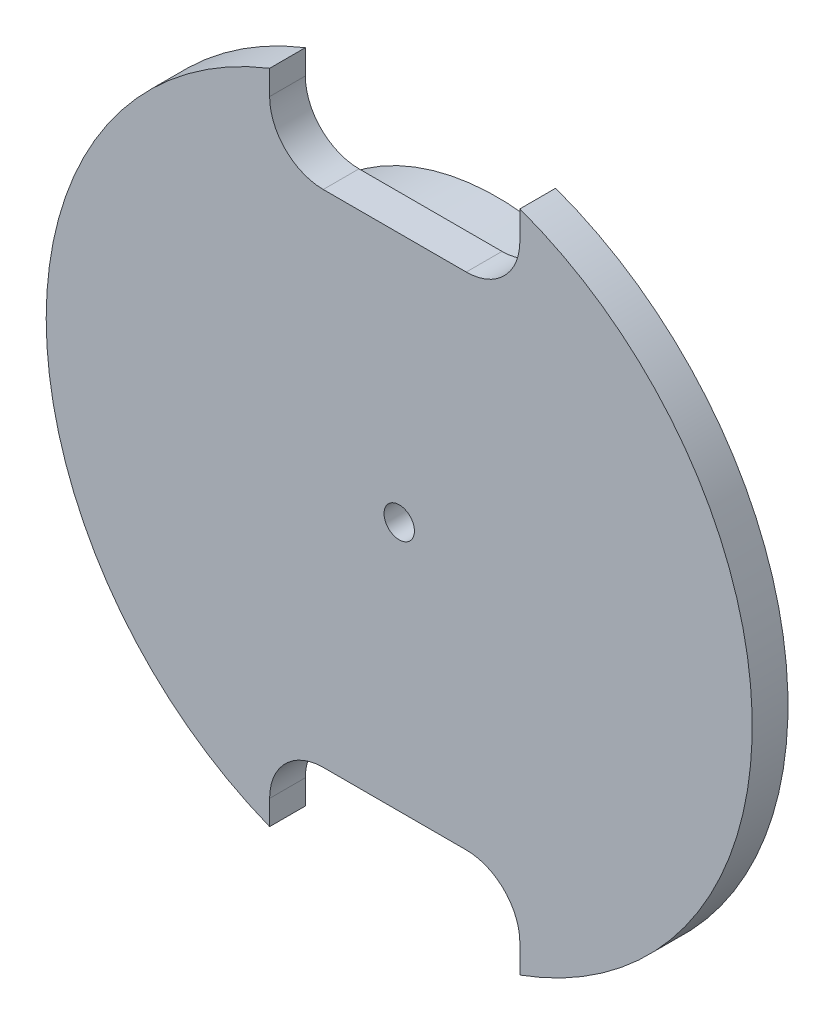
from build123d import *

# Parameters (mm, degrees)
SKETCH1_R           = 39.5
BOSS_EXTRUDE1_DEPTH = 4
CUT_EXTRUDE2_DEPTH  = 10
SKETCH7_R           = 26
BOSS_EXTRUDE2_DEPTH = 7
SKETCH8_R           = 1.7
CUT_EXTRUDE3_DEPTH  = 20
SKETCH9_R           = 5
CUT_EXTRUDE4_DEPTH  = 4


with BuildPart() as part:
    # Sketch1 → Boss-Extrude1 (new body)
    with BuildSketch(Plane.XY):
        with Locations((-12.82554103, 19.238311544)):
            Circle(SKETCH1_R)
    extrude(amount=BOSS_EXTRUDE1_DEPTH)

    # Sketch5 → Cut-Extrude2 (cut)
    with BuildSketch(Plane.XY.offset(4)):
        with BuildLine():
            Line((-27.32554103, 65.055026052), (-27.32554103, 53.238311544))
            ThreePointArc((-27.32554103, 53.238311544), (-25.568181717, 48.995670857), (-21.32554103, 47.238311544))
            Line((-21.32554103, 47.238311544), (-5.32554103, 47.238311544))
            ThreePointArc((-5.32554103, 47.238311544), (-1.082900342, 48.995670857), (0.67445897, 53.238311544))
            Line((0.67445897, 53.238311544), (0.67445897, 65.055026052))
            Line((0.67445897, 65.055026052), (-27.32554103, 65.055026052))
        make_face()
        with BuildLine():
            Line((-5.32554103, -8.761688456), (-21.32554103, -8.761688456))
            ThreePointArc((-21.32554103, -8.761688456), (-25.568181717, -10.519047769), (-27.32554103, -14.761688456))
            Line((-27.32554103, -14.761688456), (-27.32554103, -23.849725684))
            Line((-27.32554103, -23.849725684), (0.67445897, -23.849725684))
            Line((0.67445897, -23.849725684), (0.67445897, -14.761688456))
            ThreePointArc((0.67445897, -14.761688456), (-1.082900342, -10.519047769), (-5.32554103, -8.761688456))
        make_face()
    extrude(amount=-CUT_EXTRUDE2_DEPTH, mode=Mode.SUBTRACT)

    # Sketch7 → Boss-Extrude2 (add)
    with BuildSketch(Plane(origin=(0, 0, 0), x_dir=(-1, 0, 0), z_dir=(0, 0, -1))):
        with Locations((12.82554103, 19.238311544)):
            Circle(SKETCH7_R)
    extrude(amount=BOSS_EXTRUDE2_DEPTH)

    # Sketch8 → Cut-Extrude3 (cut)
    with BuildSketch(Plane(origin=(0, 0, -7), x_dir=(-1, 0, 0), z_dir=(0, 0, -1))):
        with Locations((12.82554103, 19.238311544)):
            Circle(SKETCH8_R)
    extrude(amount=-CUT_EXTRUDE3_DEPTH, mode=Mode.SUBTRACT)

    # Sketch9 → Cut-Extrude4 (cut)
    with BuildSketch(Plane(origin=(0, 0, -7), x_dir=(-1, 0, 0), z_dir=(0, 0, -1))):
        with Locations((12.82554103, 19.238311544)):
            Circle(SKETCH9_R)
    extrude(amount=-CUT_EXTRUDE4_DEPTH, mode=Mode.SUBTRACT)


solid = part.part
